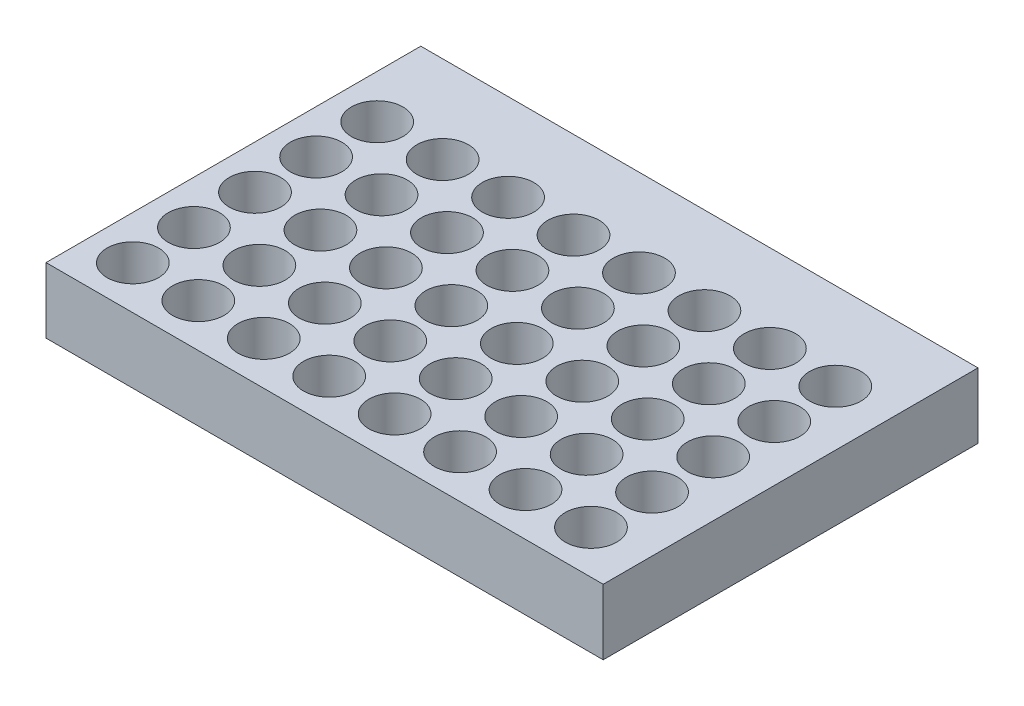
from build123d import *

# Parameters (mm, degrees)
SKETCH1_W            = 127.7
SKETCH1_H            = 85.9
BOSS_EXTRUDE1_DEPTH  = 15
SKETCH2_R            = 5.9
CUT_EXTRUDE1_DEPTH   = 12
LPATTERN3_COUNT      = 8
LPATTERN3_PITCH      = 15
LPATTERN3_COUNT_DIR2 = 5
LPATTERN3_PITCH_DIR2 = 14
SKETCH3_R            = 2
CUT_EXTRUDE2_DEPTH   = 12
LPATTERN4_COUNT      = 8
LPATTERN4_PITCH      = 15
LPATTERN4_COUNT_DIR2 = 5
LPATTERN4_PITCH_DIR2 = 14


with BuildPart() as part:
    # Sketch1 → Boss-Extrude1 (new body)
    with BuildSketch(Plane(origin=(0, 0, 0), x_dir=(1, 0, 0), z_dir=(0, 1, 0))):
        with Locations((-248.856003869, 89.066665881)):
            Rectangle(SKETCH1_W, SKETCH1_H)
    extrude(amount=BOSS_EXTRUDE1_DEPTH)

    # Sketch2 → Cut-Extrude1 (cut)
    with BuildSketch(Plane(origin=(0, 15, 0), x_dir=(1, 0, 0), z_dir=(0, 1, 0))):
        with Locations((-302.706003869, 112.016665881)):
            Circle(SKETCH2_R)
    cut_extrude1 = extrude(amount=-CUT_EXTRUDE1_DEPTH, mode=Mode.SUBTRACT)

    # LPattern3: Cut-Extrude1 8 × 5
    with Locations(*[(i * LPATTERN3_PITCH, 0, j * LPATTERN3_PITCH_DIR2) for i in range(LPATTERN3_COUNT) for j in range(LPATTERN3_COUNT_DIR2) if (i, j) != (0, 0)]):
        add(cut_extrude1, mode=Mode.SUBTRACT)

    # Sketch3 → Cut-Extrude2 (cut)
    with BuildSketch(Plane(origin=(0, 3, 0), x_dir=(1, 0, 0), z_dir=(0, 1, 0))):
        with Locations((-302.706003869, 112.016665881)):
            Circle(SKETCH3_R)
    cut_extrude2 = extrude(amount=-CUT_EXTRUDE2_DEPTH, mode=Mode.SUBTRACT)

    # LPattern4: Cut-Extrude2 8 × 5
    with Locations(*[(i * LPATTERN4_PITCH, 0, j * LPATTERN4_PITCH_DIR2) for i in range(LPATTERN4_COUNT) for j in range(LPATTERN4_COUNT_DIR2) if (i, j) != (0, 0)]):
        add(cut_extrude2, mode=Mode.SUBTRACT)


solid = part.part
